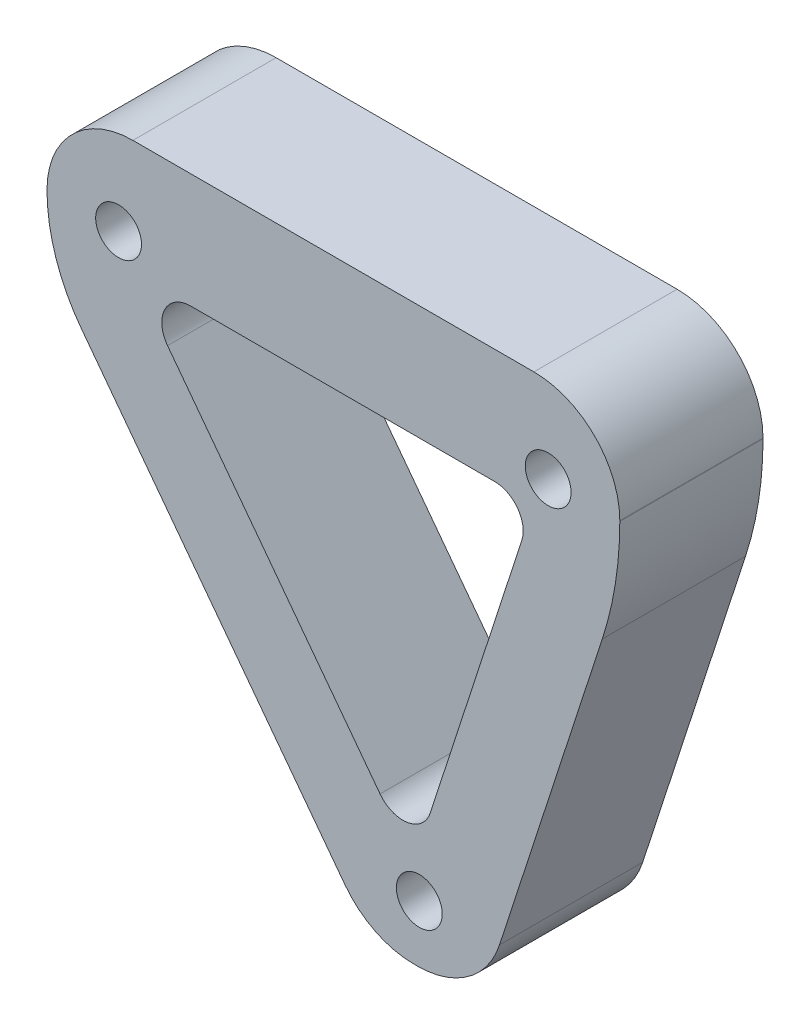
from build123d import *

# Parameters (mm, degrees)
EXTRUDE_1_OUTLINE_R = 1.6
EXTRUDE_1_DEPTH     = 10
CUT_EXTRUDE_2_DEPTH = 10


# Read off the part's stored shape, not the designer's step: 凸台-拉伸1
with BuildPart() as part:
    # 凸台-拉伸1 outline → 凸台-拉伸1 (new body)
    with BuildSketch(Plane.XY):
        with BuildLine():
            Line((31.599493043, -25.854101966), (38.776412907, -3.765813851))
            ThreePointArc((38.776412907, -3.765813851), (39.692208515, 0.048749382), (40, 3.959611008))
            Line((40, 3.959611008), (40, 4))
            ThreePointArc((40, 4), (38.242640687, 8.242640687), (34, 10))
            Line((34, 10), (6, 10))
            ThreePointArc((6, 10), (1.757359313, 8.242640687), (0, 4))
            ThreePointArc((0, 4), (0.622521006, 0.200308091), (2.416373879, -3.206636444))
            Line((2.416373879, -3.206636444), (20.806298091, -27.610890139))
            ThreePointArc((20.806298091, -27.610890139), (22.920924272, -29.36960617), (25.598111151, -30))
            Line((25.598111151, -30), (25.893153945, -30))
            ThreePointArc((25.893153945, -30), (29.419865459, -28.854101966), (31.599493043, -25.854101966))
        make_face()
        with Locations((26, -25.992428083)):
            Circle(EXTRUDE_1_OUTLINE_R, mode=Mode.SUBTRACT)
        with Locations((5, 4.007571917)):
            Circle(EXTRUDE_1_OUTLINE_R, mode=Mode.SUBTRACT)
        with Locations((35, 4.007571917)):
            Circle(EXTRUDE_1_OUTLINE_R, mode=Mode.SUBTRACT)
    extrude(amount=EXTRUDE_1_DEPTH)

    # 草图3 → 切除-拉伸2 (cut)
    with BuildSketch(Plane.XY.offset(10)):
        with BuildLine():
            ThreePointArc((8.419814245, -1.203630046), (8.227216542, 0.892395626), (10.017085265, 2))
            Line((10.017085265, 2), (31.252942008, 2))
            ThreePointArc((31.252942008, 2), (32.870975997, 1.175570505), (33.15505504, -0.618033989))
            Line((33.15505504, -0.618033989), (26.757172713, -20.3086911))
            ThreePointArc((26.757172713, -20.3086911), (25.185154892, -21.663228314), (23.25778866, -20.894287158))
            Line((23.25778866, -20.894287158), (8.419814245, -1.203630046))
        make_face()
    extrude(amount=-CUT_EXTRUDE_2_DEPTH, mode=Mode.SUBTRACT)


solid = part.part
